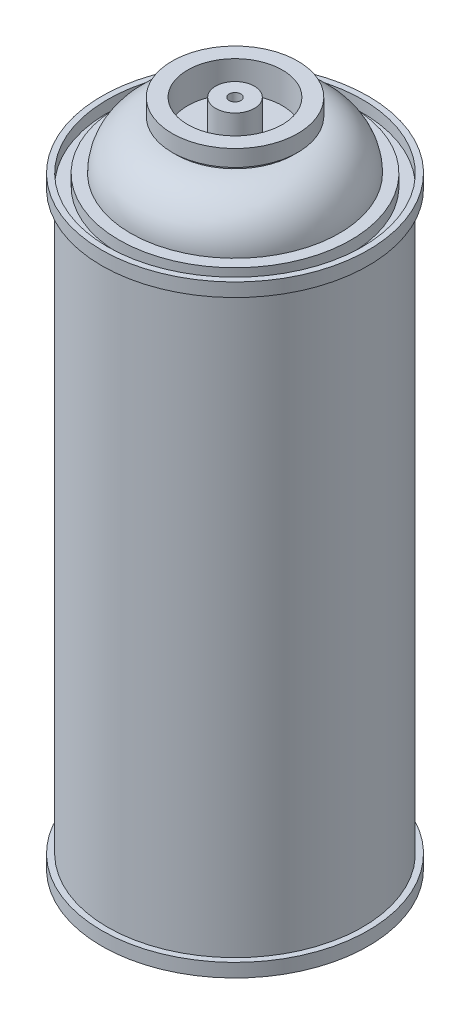
from build123d import *

# Parameters (mm, degrees)
SKETCH1_R           = 33
BOSS_EXTRUDE1_DEPTH = 156
SKETCH3_R           = 34.5
BOSS_EXTRUDE2_DEPTH = 3.5
LPATTERN1_COUNT     = 2
LPATTERN1_PITCH     = 152.5
SKETCH6_R           = 1.5
CUT_EXTRUDE1_DEPTH  = 3.5
CUT_EXTRUDE2_START  = -3
SKETCH7_R           = 33
SKETCH7_R_2         = 30
CUT_EXTRUDE2_DEPTH  = 3


with BuildPart() as part:
    # Sketch1 → Boss-Extrude1 (new body)
    with BuildSketch(Plane(origin=(0, 0, 0), x_dir=(1, 0, 0), z_dir=(0, 1, 0))):
        Circle(SKETCH1_R)
    extrude(amount=BOSS_EXTRUDE1_DEPTH)

    # Sketch2 → Revolve1 (revolve)
    with BuildSketch(Plane(origin=(0, 0, 0), x_dir=(0, 0, -1), z_dir=(1, 0, 0))):
        with BuildLine():
            Line((15.25, 167.75), (15.25, 168.75))
            Line((15.25, 168.75), (16.25, 168.75))
            Line((16.25, 168.75), (16.25, 173))
            Line((16.25, 173), (12.25, 173))
            Line((12.25, 173), (12.25, 165))
            Line((12.25, 165), (5, 165))
            Line((5, 165), (5, 173))
            Line((5, 173), (0, 173))
            Line((0, 173), (0, 156))
            Line((0, 156), (27, 156))
            ThreePointArc((27, 156), (23.558504679, 164.308504679), (15.25, 167.75))
        make_face()
    revolve(axis=Axis((0, 173, 0), (0, -1, 0)))

    # Sketch3 → Boss-Extrude2 (add)
    with BuildSketch(Plane(origin=(0, 156, 0), x_dir=(1, 0, 0), z_dir=(0, 1, 0))):
        Circle(SKETCH3_R)
    boss_extrude2 = extrude(amount=-BOSS_EXTRUDE2_DEPTH)

    # LPattern1: Boss-Extrude2 ×2
    with Locations(*[(0, -i * LPATTERN1_PITCH, 0) for i in range(1, LPATTERN1_COUNT)]):
        add(boss_extrude2)

    # Sketch5 → Cut-Revolve1 (revolve, cut)
    with BuildSketch(Plane.XY):
        with BuildLine():
            Line((0, 0), (-32.5, 0))
            ThreePointArc((-32.5, 0), (-17.322312201, 8.904178879), (0, 12))
            Line((0, 12), (0, 0))
        make_face()
    revolve(axis=Axis((0, 12, 0), (0, -1, 0)), mode=Mode.SUBTRACT)

    # Sketch6 → Cut-Extrude1 (cut)
    with BuildSketch(Plane(origin=(0, 173, 0), x_dir=(1, 0, 0), z_dir=(0, 1, 0))):
        Circle(SKETCH6_R)
    extrude(amount=-CUT_EXTRUDE1_DEPTH, mode=Mode.SUBTRACT)

    # Sketch7 → Cut-Extrude2 (cut)
    with BuildSketch(Plane(origin=(0, 156, 0), x_dir=(1, 0, 0), z_dir=(0, 1, 0)).offset(CUT_EXTRUDE2_START)):
        Circle(SKETCH7_R)
        Circle(SKETCH7_R_2, mode=Mode.SUBTRACT)
    extrude(amount=CUT_EXTRUDE2_DEPTH, mode=Mode.SUBTRACT)


solid = part.part
